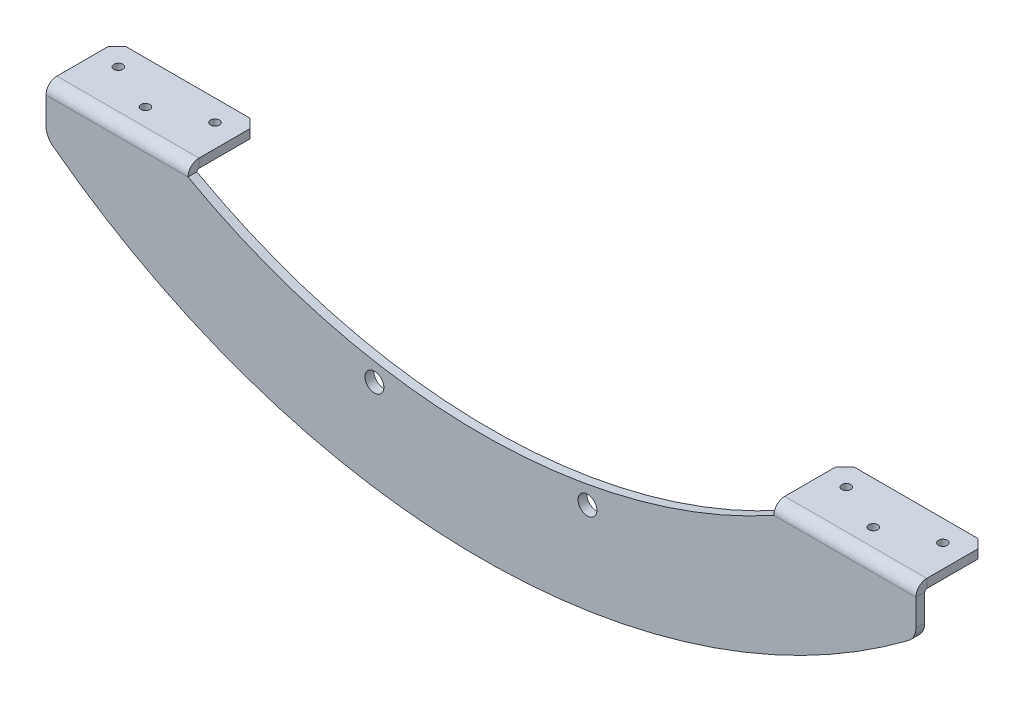
from build123d import *

# Parameters (mm, degrees)
BASE_FLANGE1_DEPTH        = 3.175
EDGE_FLANGE1_DEPTH        = 50.8
EDGE_FLANGE1_BEND_DEPTH   = 50.8
SKETCH25_R                = 3.3782
CUT_EXTRUDE1_DEPTH        = 320.039055649
BREAK_CORNER1_START       = 15.715448212
BREAK_CORNER1_OUTLINE_W   = 184.095250482
BREAK_CORNER1_OUTLINE_H   = 6
BREAK_CORNER1_DEPTH       = 152.664354058
BREAK_CORNER1_START_2     = -17.960512242
BREAK_CORNER1_2_OUTLINE_W = 37.636472696
BREAK_CORNER1_2_OUTLINE_H = 6
BREAK_CORNER1_2_DEPTH     = 2.24506403
BREAK_CORNER1_START_3     = 199.810698694
BREAK_CORNER1_3_OUTLINE_W = 2.268276822
BREAK_CORNER1_3_OUTLINE_H = 6
BREAK_CORNER1_3_DEPTH     = 4.49012806
SKETCH26_R                = 1.5875
CUT_EXTRUDE2_DEPTH        = 320.868403774
SKETCH27_R                = 1.5875
CUT_EXTRUDE3_DEPTH        = 320.868403774


# Read off the part's stored shape, not the designer's step: Break-Corner1
# Sheet-metal steps are written as plain solids
with BuildPart() as part:
    # Sketch2 → Base-Flange1 (new body)
    with BuildSketch(Plane.XY):
        with BuildLine():
            Line((0, 0), (50.8, 0))
            ThreePointArc((50.8, 0), (155.575, -27.127625498), (260.35, 0))
            Line((260.35, 0), (311.15, 0))
            Line((311.15, 0), (311.15, -9.556040603))
            ThreePointArc((311.15, -9.556040603), (310.481801777, -12.39146448), (308.617833524, -14.630156012))
            ThreePointArc((308.617833524, -14.630156012), (155.575, -65.775653014), (2.532166476, -14.630156012))
            ThreePointArc((2.532166476, -14.630156012), (0.668198223, -12.39146448), (0, -9.556040603))
            Line((0, -9.556040603), (0, 0))
        make_face()
    extrude(amount=-BASE_FLANGE1_DEPTH)

    # Edge-Flange1 section (across the edge) → Edge-Flange1 (add)
    with BuildSketch(Plane(origin=(0, 0.7366, -3.175), x_dir=(0, -1, 0), z_dir=(1, 0, 0))):
        with BuildLine():
            Line((-3.175, 0.7366), (-3.175, 22.225))
            Line((-3.175, 22.225), (0, 22.225))
            Line((0, 22.225), (0, 0.7366))
            ThreePointArc((0, 0.7366), (0.215745145, 0.215745145), (0.7366, 0))
            Line((0.7366, 0), (0.7366, -3.175))
            ThreePointArc((0.7366, -3.175), (-2.029318885, -2.029318885), (-3.175, 0.7366))
        make_face()
    extrude(amount=EDGE_FLANGE1_DEPTH)

    # Edge-Flange1 section 2 (across the edge) → Edge-Flange1 bend (add)
    with BuildSketch(Plane(origin=(260.35, 0.7366, -3.175), x_dir=(0, -1, 0), z_dir=(1, 0, 0))):
        with BuildLine():
            Line((-3.175, 0.7366), (-3.175, 22.225))
            Line((-3.175, 22.225), (0, 22.225))
            Line((0, 22.225), (0, 0.7366))
            ThreePointArc((0, 0.7366), (0.215745145, 0.215745145), (0.7366, 0))
            Line((0.7366, 0), (0.7366, -3.175))
            ThreePointArc((0.7366, -3.175), (-2.029318885, -2.029318885), (-3.175, 0.7366))
        make_face()
    extrude(amount=EDGE_FLANGE1_BEND_DEPTH)

    # Sketch25 → Cut-Extrude1 (cut, through all)
    with BuildSketch(Plane.XY):
        with Locations((117.475, -30.187559048)):
            Circle(SKETCH25_R)
        with Locations((193.675, -30.187559048)):
            Circle(SKETCH25_R)
    extrude(amount=-CUT_EXTRUDE1_DEPTH, mode=Mode.SUBTRACT)

    # Break-Corner1 outline → Break-Corner1 (cut)
    with BuildSketch(Plane(origin=(0, 0, 0), x_dir=(0.707106781186548, 0, -0.707106781186547), z_dir=(0.707106781186547, 0, 0.707106781186548)).offset(BREAK_CORNER1_START)):
        with Locations((143.684097937, 2)):
            Rectangle(BREAK_CORNER1_OUTLINE_W, BREAK_CORNER1_OUTLINE_H)
    extrude(amount=BREAK_CORNER1_DEPTH, mode=Mode.SUBTRACT)

    # Break-Corner1 2 outline → Break-Corner1 2 (cut)
    with BuildSketch(Plane(origin=(0, 0, 0), x_dir=(0.707106781186548, 0, -0.707106781186547), z_dir=(0.707106781186547, 0, 0.707106781186548)).offset(BREAK_CORNER1_START_2)):
        with Locations((32.818236348, 2)):
            Rectangle(BREAK_CORNER1_2_OUTLINE_W, BREAK_CORNER1_2_OUTLINE_H)
    extrude(amount=BREAK_CORNER1_2_DEPTH, mode=Mode.SUBTRACT)

    # Break-Corner1 3 outline → Break-Corner1 3 (cut)
    with BuildSketch(Plane(origin=(0, 0, 0), x_dir=(0.707106781186548, 0, -0.707106781186547), z_dir=(0.707106781186547, 0, 0.707106781186548)).offset(BREAK_CORNER1_START_3)):
        with Locations((236.865861589, 2)):
            Rectangle(BREAK_CORNER1_3_OUTLINE_W, BREAK_CORNER1_3_OUTLINE_H)
    extrude(amount=BREAK_CORNER1_3_DEPTH, mode=Mode.SUBTRACT)

    # Sketch26 → Cut-Extrude2 (cut, through all)
    with BuildSketch(Plane(origin=(0, 3.9116, 0), x_dir=(1, 0, 0), z_dir=(0, 1, 0))):
        with Locations(Location((8.128, 17.78, 0), (0, 0, 270))):
            Circle(SKETCH26_R)
        with Locations(Location((25.4, 10.16, 0), (0, 0, 270))):
            Circle(SKETCH26_R)
        with Locations(Location((42.672, 17.78, 0), (0, 0, 270))):
            Circle(SKETCH26_R)
    extrude(amount=-CUT_EXTRUDE2_DEPTH, mode=Mode.SUBTRACT)

    # Sketch27 → Cut-Extrude3 (cut, through all)
    with BuildSketch(Plane(origin=(0, 3.9116, 0), x_dir=(1, 0, 0), z_dir=(0, 1, 0))):
        with Locations(Location((268.478, 17.78, 0), (0, 0, 270))):
            Circle(SKETCH27_R)
        with Locations(Location((303.022, 17.78, 0), (0, 0, 270))):
            Circle(SKETCH27_R)
        with Locations(Location((285.75, 10.16, 0), (0, 0, 270))):
            Circle(SKETCH27_R)
    extrude(amount=-CUT_EXTRUDE3_DEPTH, mode=Mode.SUBTRACT)


solid = part.part
